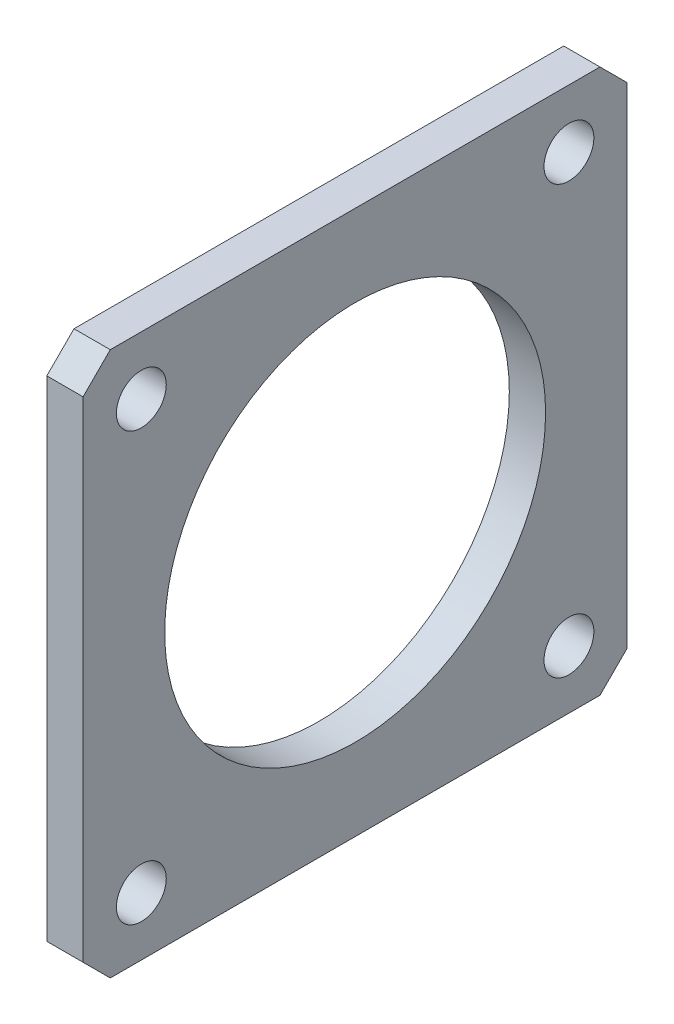
from build123d import *

# Parameters (mm, degrees)
SZKIC1_W                = 60
SZKIC1_H                = 60
SZKIC1_R                = 21
ODGI_CIE_BAZOWE1_DEPTH  = 4
OTW_R_POD_RUB_M51_D     = 5.5
OTW_R_POD_RUB_M51_DEPTH = 11
OTW_R_POD_RUB_M51_TIP   = 1.652366702
SFAZOWANIE1_SIZE        = 3


# Sheet-metal steps are written as plain solids
with BuildPart() as part:
    # Szkic1 → Odgięcie bazowe1 (new body)
    with BuildSketch(Plane(origin=(0, 0, 0), x_dir=(0, 0, -1), z_dir=(1, 0, 0))):
        Rectangle(SZKIC1_W, SZKIC1_H)
        Circle(SZKIC1_R, mode=Mode.SUBTRACT)
    extrude(amount=-ODGI_CIE_BAZOWE1_DEPTH)

    # Otwór pod śrubę M51
    with Locations(Plane(origin=(0, 0, 0), x_dir=(0, 0, -1), z_dir=(1, 0, 0))):
        with Locations((-23.575, 23.575), (23.575, 23.575), (23.575, -23.575), (-23.575, -23.575)):
            Hole(OTW_R_POD_RUB_M51_D / 2, depth=OTW_R_POD_RUB_M51_DEPTH)
            with Locations((0, 0, -(OTW_R_POD_RUB_M51_DEPTH + OTW_R_POD_RUB_M51_TIP / 2))):  # 118° drill point
                Cone(0, OTW_R_POD_RUB_M51_D / 2, OTW_R_POD_RUB_M51_TIP, mode=Mode.SUBTRACT)

    # Sfazowanie1
    sfazowanie1_edges = [part.edges().sort_by_distance(p)[0] for p in [
        (-2, -30, -30),
        (-2, -30, 30),
        (-2, 30, 30),
        (-2, 30, -30),
    ]]
    chamfer(sfazowanie1_edges, length=SFAZOWANIE1_SIZE)


solid = part.part
